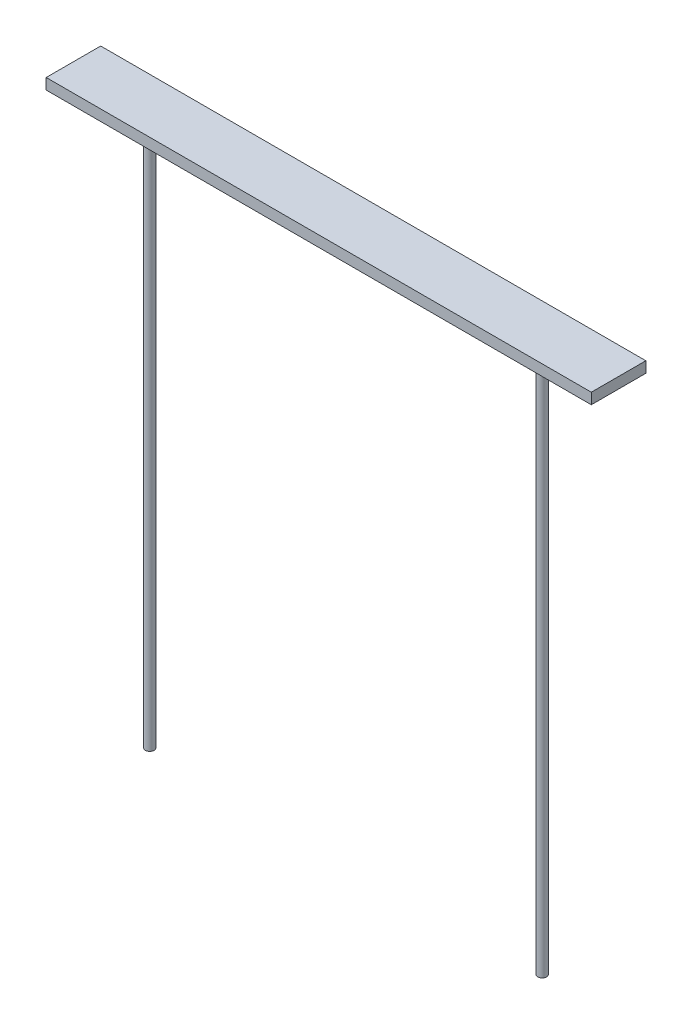
from build123d import *

# Parameters (mm, degrees)
SKETCH1_W           = 500
SKETCH1_H           = 50
BOSS_EXTRUDE1_DEPTH = 10
SKETCH2_R           = 4
BOSS_EXTRUDE2_DEPTH = 500
SKETCH6_R           = 4
BOSS_EXTRUDE3_DEPTH = 500


with BuildPart() as part:
    # Sketch1 → Boss-Extrude1 (new body)
    with BuildSketch(Plane(origin=(0, 0, 0), x_dir=(1, 0, 0), z_dir=(0, 1, 0))):
        Rectangle(SKETCH1_W, SKETCH1_H)
    extrude(amount=BOSS_EXTRUDE1_DEPTH)

    # Sketch2 → Boss-Extrude2 (add)
    with BuildSketch(Plane.XZ):
        with Locations((180, 0)):
            Circle(SKETCH2_R)
    extrude(amount=BOSS_EXTRUDE2_DEPTH)

    # Sketch6 → Boss-Extrude3 (add)
    with BuildSketch(Plane.XZ):
        with Locations((-180, 0)):
            Circle(SKETCH6_R)
    extrude(amount=BOSS_EXTRUDE3_DEPTH)


solid = part.part
